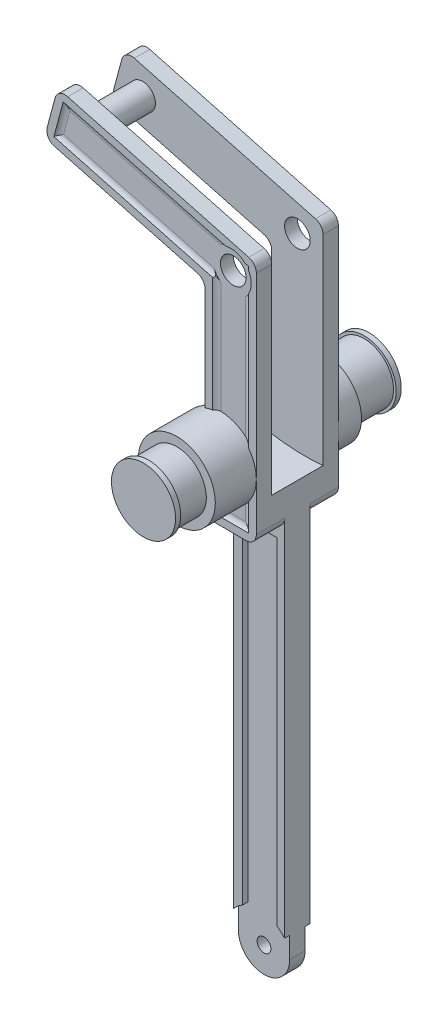
from build123d import *

# Parameters (mm, degrees)
ESTRUSIONE_ESTRUSIONE1_DEPTH  = 3
SCHIZZO4_R                    = 2.5
ESTRUSIONE_ESTRUSIONE4_DEPTH  = 5
ESTRUSIONE_ESTRUSIONE5_DEPTH  = 10
ESTRUSIONE_ESTRUSIONE6_START  = -13
ESTRUSIONE_ESTRUSIONE6_DEPTH  = 3
ESTRUSIONE_ESTRUSIONE7_DEPTH  = 2.5
TAGLIO_ESTRUSIONE1_DEPTH      = 0.5
TAGLIO_ESTRUSIONE2_DEPTH      = 0.5
RACCORDO1_R                   = 1.5
SCHIZZO13_R                   = 2.5
TAGLIO_ESTRUSIONE5_DEPTH      = 275
SCHIZZO14_W                   = 10
SCHIZZO14_H                   = 5
ESTRUSIONE_ESTRUSIONE8_DEPTH  = 10
TAGLIO_ESTRUSIONE6_DEPTH      = 10
SCHIZZO17_R                   = 1.35
TAGLIO_ESTRUSIONE7_DEPTH      = 10
TAGLIO_ESTRUSIONE8_DEPTH      = 1
TAGLIO_ESTRUSIONE9_DEPTH      = 1
SCHIZZO20_R                   = 4
TAGLIO_ESTRUSIONE10_DEPTH     = 4
SCHIZZO21_R                   = 7.5
ESTRUSIONE_ESTRUSIONE9_DEPTH  = 8.5
RACCORDO6_R                   = 2
ESTRUSIONE_ESTRUSIONE10_START = 5
SCHIZZO23_R                   = 7.5
ESTRUSIONE_ESTRUSIONE10_DEPTH = 5
RACCORDO9_R                   = 2
SCHIZZO25_R                   = 5.75
ESTRUSIONE_ESTRUSIONE11_DEPTH = 6.5
ESTRUSIONE_ESTRUSIONE12_START = 9
SCHIZZO26_R                   = 5.75
ESTRUSIONE_ESTRUSIONE12_DEPTH = 9
SCHIZZO28_R                   = 6.25
ESTRUSIONE_ESTRUSIONE13_DEPTH = 1
ESTRUSIONE_ESTRUSIONE14_START = -1
SCHIZZO29_R                   = 6.25
ESTRUSIONE_ESTRUSIONE14_DEPTH = 1


with BuildPart() as part:
    # Schizzo1 → Estrusione-Estrusione1 (new body)
    with BuildSketch(Plane.XY):
        with BuildLine():
            Line((0, -1.534653976), (0, -38))
            ThreePointArc((0, -38), (0.585786438, -39.414213562), (2, -40))
            Line((2, -40), (8, -40))
            ThreePointArc((8, -40), (9.414213562, -39.414213562), (10, -38))
            Line((10, -38), (10, 6.138615904))
            ThreePointArc((10, 6.138615904), (9.586706681, 7.356138762), (8.51763809, 8.070467556))
            Line((8.51763809, 8.070467556), (-26.774053122, 17.526847716))
            ThreePointArc((-26.774053122, 17.526847716), (-28.291691212, 17.327046871), (-29.223542865, 16.112634154))
            Line((-29.223542865, 16.112634154), (-30.776457135, 10.317079196))
            ThreePointArc((-30.776457135, 10.317079196), (-30.57665629, 8.799441106), (-29.362243573, 7.867589453))
            Line((-29.362243573, 7.867589453), (-1.48236191, 0.397197677))
            ThreePointArc((-1.48236191, 0.397197677), (-0.413293319, -0.317131118), (0, -1.534653976))
        make_face()
    extrude(amount=-ESTRUSIONE_ESTRUSIONE1_DEPTH)

    # Schizzo4 → Estrusione-Estrusione4 (add)
    with BuildSketch(Plane(origin=(0, 0, -3), x_dir=(-1, 0, 0), z_dir=(0, 0, -1))):
        with Locations(Location((25.170370869, 11.920761449, 0), (0, 0, 180))):
            Circle(SCHIZZO4_R)
    estrusione_estrusione4 = extrude(amount=ESTRUSIONE_ESTRUSIONE4_DEPTH)

    # Schizzo5 → Estrusione-Estrusione5 (add)
    with BuildSketch(Plane(origin=(0, 0, -3), x_dir=(-1, 0, 0), z_dir=(0, 0, -1))):
        with BuildLine():
            Line((-10, -32.854406154), (-10, -38))
            ThreePointArc((-10, -38), (-9.414213562, -39.414213562), (-8, -40))
            Line((-8, -40), (-2, -40))
            ThreePointArc((-2, -40), (-0.585786438, -39.414213562), (0, -38))
            Line((0, -38), (0, -32.476991219))
            ThreePointArc((0, -32.476991219), (-4.988150852, -32.979654151), (-10, -32.854406154))
        make_face()
    estrusione_estrusione5 = extrude(amount=ESTRUSIONE_ESTRUSIONE5_DEPTH)

    # Specchia5: Estrusione-Estrusione4, Estrusione-Estrusione5 across Piano2
    add(estrusione_estrusione4.mirror(Plane(origin=(0, 0, -8), x_dir=(-1, 0, 0), z_dir=(0, 0, -1))))
    add(estrusione_estrusione5.mirror(Plane(origin=(0, 0, -8), x_dir=(-1, 0, 0), z_dir=(0, 0, -1))))

    # Schizzo1<5> → Estrusione-Estrusione6 (add)
    with BuildSketch(Plane.XY.offset(ESTRUSIONE_ESTRUSIONE6_START)):
        with BuildLine():
            Line((0, -1.534653976), (0, -38))
            ThreePointArc((0, -38), (0.585786438, -39.414213562), (2, -40))
            Line((2, -40), (8, -40))
            ThreePointArc((8, -40), (9.414213562, -39.414213562), (10, -38))
            Line((10, -38), (10, 6.138615904))
            ThreePointArc((10, 6.138615904), (9.586706681, 7.356138762), (8.51763809, 8.070467556))
            Line((8.51763809, 8.070467556), (-26.774053122, 17.526847716))
            ThreePointArc((-26.774053122, 17.526847716), (-28.291691212, 17.327046871), (-29.223542865, 16.112634154))
            Line((-29.223542865, 16.112634154), (-30.776457135, 10.317079196))
            ThreePointArc((-30.776457135, 10.317079196), (-30.57665629, 8.799441106), (-29.362243573, 7.867589453))
            Line((-29.362243573, 7.867589453), (-1.48236191, 0.397197677))
            ThreePointArc((-1.48236191, 0.397197677), (-0.413293319, -0.317131118), (0, -1.534653976))
        make_face()
    extrude(amount=-ESTRUSIONE_ESTRUSIONE6_DEPTH)

    # Schizzo8 → Estrusione-Estrusione7 (add, symmetric)
    with BuildSketch(Plane(origin=(0, 0, -8), x_dir=(-1, 0, 0), z_dir=(0, 0, -1))):
        with BuildLine():
            Line((-8, -40), (-2, -40))
            ThreePointArc((-2, -40), (-0.585786438, -39.414213562), (0, -38))
            Line((0, -38), (0, -108))
            Line((0, -108), (-10, -108))
            Line((-10, -108), (-10, -38))
            ThreePointArc((-10, -38), (-9.414213562, -39.414213562), (-8, -40))
        make_face()
    extrude(amount=ESTRUSIONE_ESTRUSIONE7_DEPTH, both=True)

    # Schizzo9 → Taglio-Estrusione1 (cut, symmetric)
    with BuildSketch(Plane(origin=(0, 0, -16), x_dir=(-1, 0, 0), z_dir=(0, 0, -1))):
        Polygon((-8.5, -38.5), (-8.5, 6.522279398), (27.645244603, 16.207368499), (29.456977918, 9.445887715), (-1.5, 1.150990482), (-1.5, -38.5), align=None)
    extrude(amount=TAGLIO_ESTRUSIONE1_DEPTH, both=True, mode=Mode.SUBTRACT)

    # Schizzo10 → Taglio-Estrusione2 (cut, symmetric)
    with BuildSketch(Plane.XY):
        Polygon((8.5, 6.522279398), (-27.645244603, 16.207368499), (-29.456977918, 9.445887715), (1.5, 1.150990482), (1.5, -38.5), (8.5, -38.5), (8.5, -0.724653865), align=None)
    extrude(amount=TAGLIO_ESTRUSIONE2_DEPTH, both=True, mode=Mode.SUBTRACT)

    # Raccordo1
    # the kernel refuses this fillet: 1.5 mm, written as the material it adds along each edge
    with BuildSketch(Plane(origin=(1.5, -38.5, -0.5), x_dir=(0, 0, 1), z_dir=(1, 0, 0)), Plane(origin=(-27.645244603, 16.207368499, -0.5), x_dir=(0, 0, 1), z_dir=(-0.2588190451025157, -0.9659258262890696, 0))) as raccordo1_piece_1:
        with BuildLine():
            CenterArc((1.5, -1.118033989), RACCORDO1_R, 131.810314896, 48.189685104)
            Line((0, -1.118033989), (0, 0))
            Line((0, 0), (0.5, 0))
        make_face()
    extrude(amount=7)
    with BuildSketch(Plane(origin=(8.5, -38.5, -0.5), x_dir=(0, 0, 1), z_dir=(0, 1, 0))) as raccordo1_piece_2_section:
        with BuildLine():
            CenterArc((1.5, -1.118033989), RACCORDO1_R, 131.810314896, 48.189685104)
            Line((0, -1.118033989), (0, 0))
            Line((0, 0), (0.5, 0))
        make_face()
    raccordo1_piece_2 = extrude(amount=47.81736437, mode=Mode.PRIVATE)
    raccordo1_piece_2 = split(raccordo1_piece_2, bisect_by=Plane(origin=(19.755569849, 3.506358546, -0.5), z_dir=(-0.2588190451025174, -0.9659258262890692, 0)), keep=Keep.TOP, mode=Mode.PRIVATE)
    add(raccordo1_piece_2)
    with BuildSketch(Plane(origin=(1.5, 3.946075454, -0.5), x_dir=(0, 0, 1), z_dir=(0, -1, 0))) as raccordo1_piece_3_section:
        with BuildLine():
            CenterArc((1.5, -1.118033989), RACCORDO1_R, 131.810314896, 48.189685104)
            Line((0, -1.118033989), (0, 0))
            Line((0, 0), (0.5, 0))
        make_face()
    raccordo1_piece_3 = extrude(amount=42.446075454, mode=Mode.PRIVATE)
    raccordo1_piece_3 = split(raccordo1_piece_3, bisect_by=Plane(origin=(0.801228757, 1.338225672, -0.5), z_dir=(-0.2588190451025179, -0.9659258262890691, 0)), keep=Keep.TOP, mode=Mode.PRIVATE)
    add(raccordo1_piece_3)
    with BuildSketch(Plane(origin=(-29.456977918, 9.445887715, -0.5), x_dir=(0, 0, 1), z_dir=(0.9659258262890691, -0.2588190451025179, 0))) as raccordo1_piece_4_section:
        with BuildLine():
            CenterArc((1.5, -1.118033989), RACCORDO1_R, 131.810314896, 48.189685104)
            Line((0, -1.118033989), (0, 0))
            Line((0, 0), (0.5, 0))
        make_face()
    raccordo1_piece_4 = extrude(amount=34.844106828, mode=Mode.PRIVATE)
    raccordo1_piece_4 = split(raccordo1_piece_4, bisect_by=Plane(origin=(1.5, 9.445887715, -0.5), z_dir=(-1, 0, 0)), keep=Keep.TOP, mode=Mode.PRIVATE)
    add(raccordo1_piece_4)
    with BuildSketch(Plane(origin=(11.199844761, 5.798858174, -0.5), x_dir=(0, 0, 1), z_dir=(-0.9659258262890692, 0.2588190451025174, 0))) as raccordo1_piece_5_section:
        with BuildLine():
            CenterArc((1.5, -1.118033989), RACCORDO1_R, 131.810314896, 48.189685104)
            Line((0, -1.118033989), (0, 0))
            Line((0, 0), (0.5, 0))
        make_face()
    raccordo1_piece_5 = extrude(amount=40.215395744, mode=Mode.PRIVATE)
    raccordo1_piece_5 = split(raccordo1_piece_5, bisect_by=Plane(origin=(8.5, 5.798858174, -0.5), z_dir=(-1, 0, 0)), keep=Keep.TOP, mode=Mode.PRIVATE)
    add(raccordo1_piece_5)
    with BuildSketch(Plane(origin=(1.5, 3.946075454, -15.5), x_dir=(0, 0, -1), z_dir=(0, -1, 0))) as raccordo1_piece_6_section:
        with BuildLine():
            CenterArc((1.5, 1.118033989), RACCORDO1_R, 180, 48.189685104)
            Line((0, 1.118033989), (0, 0))
            Line((0, 0), (0.5, 0))
        make_face()
    raccordo1_piece_6 = extrude(amount=42.446075454, mode=Mode.PRIVATE)
    raccordo1_piece_6 = split(raccordo1_piece_6, bisect_by=Plane(origin=(0.801228757, 1.338225672, -15.5), z_dir=(-0.25881904510251796, -0.9659258262890691, 0)), keep=Keep.TOP, mode=Mode.PRIVATE)
    add(raccordo1_piece_6)
    with BuildSketch(Plane(origin=(1.5, -38.5, -15.5), x_dir=(0, 0, -1), z_dir=(1, 0, 0)), Plane(origin=(-27.645244603, 16.207368499, -15.5), x_dir=(0, 0, -1), z_dir=(-0.2588190451025171, -0.9659258262890693, 0))) as raccordo1_piece_7:
        with BuildLine():
            CenterArc((1.5, 1.118033989), RACCORDO1_R, 180, 48.189685104)
            Line((0, 1.118033989), (0, 0))
            Line((0, 0), (0.5, 0))
        make_face()
    extrude(amount=7)
    with BuildSketch(Plane(origin=(8.5, -38.5, -15.5), x_dir=(0, 0, -1), z_dir=(0, 1, 0))) as raccordo1_piece_8_section:
        with BuildLine():
            CenterArc((1.5, 1.118033989), RACCORDO1_R, 180, 48.189685104)
            Line((0, 1.118033989), (0, 0))
            Line((0, 0), (0.5, 0))
        make_face()
    raccordo1_piece_8 = extrude(amount=47.81736437, mode=Mode.PRIVATE)
    raccordo1_piece_8 = split(raccordo1_piece_8, bisect_by=Plane(origin=(19.755569849, 3.506358546, -15.5), z_dir=(-0.2588190451025175, -0.9659258262890692, 0)), keep=Keep.TOP, mode=Mode.PRIVATE)
    add(raccordo1_piece_8)
    with BuildSketch(Plane(origin=(11.199844761, 5.798858174, -15.5), x_dir=(0, 0, -1), z_dir=(-0.9659258262890692, 0.2588190451025175, 0))) as raccordo1_piece_9_section:
        with BuildLine():
            CenterArc((1.5, 1.118033989), RACCORDO1_R, 180, 48.189685104)
            Line((0, 1.118033989), (0, 0))
            Line((0, 0), (0.5, 0))
        make_face()
    raccordo1_piece_9 = extrude(amount=40.215395744, mode=Mode.PRIVATE)
    raccordo1_piece_9 = split(raccordo1_piece_9, bisect_by=Plane(origin=(8.5, 5.798858174, -15.5), z_dir=(-1, 0, 0)), keep=Keep.TOP, mode=Mode.PRIVATE)
    add(raccordo1_piece_9)
    with BuildSketch(Plane(origin=(-29.456977918, 9.445887715, -15.5), x_dir=(0, 0, -1), z_dir=(0.9659258262890691, -0.25881904510251796, 0))) as raccordo1_piece_10_section:
        with BuildLine():
            CenterArc((1.5, 1.118033989), RACCORDO1_R, 180, 48.189685104)
            Line((0, 1.118033989), (0, 0))
            Line((0, 0), (0.5, 0))
        make_face()
    raccordo1_piece_10 = extrude(amount=34.844106828, mode=Mode.PRIVATE)
    raccordo1_piece_10 = split(raccordo1_piece_10, bisect_by=Plane(origin=(1.5, 9.445887715, -15.5), z_dir=(-1, 0, 0)), keep=Keep.TOP, mode=Mode.PRIVATE)
    add(raccordo1_piece_10)
    with BuildSketch(Plane(origin=(-29.456977918, 9.445887715, -0.5), x_dir=(0, 0, 1), z_dir=(0.9659258262890691, -0.2588190451025179, 0))) as raccordo1_piece_11a_section:
        with BuildLine():
            CenterArc((1.5, -1.118033989), RACCORDO1_R, 131.810314896, 48.189685104)
            Line((0, -1.118033989), (0, 0))
            Line((0, 0), (0.5, 0))
        make_face()
    raccordo1_piece_11a = extrude(amount=34.844106828, mode=Mode.PRIVATE)
    raccordo1_piece_11a = split(raccordo1_piece_11a, bisect_by=Plane(origin=(1.5, 9.445887715, -0.5), z_dir=(1, 0, 0)), keep=Keep.TOP, mode=Mode.PRIVATE)
    with BuildSketch(Plane(origin=(1.5, 3.946075454, -0.5), x_dir=(0, 0, 1), z_dir=(0, -1, 0))) as raccordo1_piece_11b_section:
        with BuildLine():
            CenterArc((1.5, -1.118033989), RACCORDO1_R, 131.810314896, 48.189685104)
            Line((0, -1.118033989), (0, 0))
            Line((0, 0), (0.5, 0))
        make_face()
    raccordo1_piece_11b = extrude(amount=42.446075454, mode=Mode.PRIVATE)
    raccordo1_piece_11b = split(raccordo1_piece_11b, bisect_by=Plane(origin=(0.801228757, 1.338225672, -0.5), z_dir=(0.2588190451025179, 0.9659258262890691, 0)), keep=Keep.TOP, mode=Mode.PRIVATE)
    raccordo1_piece_11 = raccordo1_piece_11a & raccordo1_piece_11b
    add(raccordo1_piece_11)
    with BuildSketch(Plane(origin=(-29.456977918, 9.445887715, -15.5), x_dir=(0, 0, -1), z_dir=(0.9659258262890691, -0.25881904510251796, 0))) as raccordo1_piece_12a_section:
        with BuildLine():
            CenterArc((1.5, 1.118033989), RACCORDO1_R, 180, 48.189685104)
            Line((0, 1.118033989), (0, 0))
            Line((0, 0), (0.5, 0))
        make_face()
    raccordo1_piece_12a = extrude(amount=34.844106828, mode=Mode.PRIVATE)
    raccordo1_piece_12a = split(raccordo1_piece_12a, bisect_by=Plane(origin=(1.5, 9.445887715, -15.5), z_dir=(1, 0, 0)), keep=Keep.TOP, mode=Mode.PRIVATE)
    with BuildSketch(Plane(origin=(1.5, 3.946075454, -15.5), x_dir=(0, 0, -1), z_dir=(0, -1, 0))) as raccordo1_piece_12b_section:
        with BuildLine():
            CenterArc((1.5, 1.118033989), RACCORDO1_R, 180, 48.189685104)
            Line((0, 1.118033989), (0, 0))
            Line((0, 0), (0.5, 0))
        make_face()
    raccordo1_piece_12b = extrude(amount=42.446075454, mode=Mode.PRIVATE)
    raccordo1_piece_12b = split(raccordo1_piece_12b, bisect_by=Plane(origin=(0.801228757, 1.338225672, -15.5), z_dir=(0.25881904510251796, 0.9659258262890691, 0)), keep=Keep.TOP, mode=Mode.PRIVATE)
    raccordo1_piece_12 = raccordo1_piece_12a & raccordo1_piece_12b
    add(raccordo1_piece_12)

    # Schizzo13 → Taglio-Estrusione5 (cut, symmetric)
    with BuildSketch(Plane.XY.offset(-0.5)):
        with Locations((5, 3.83663494)):
            Circle(SCHIZZO13_R)
    extrude(amount=TAGLIO_ESTRUSIONE5_DEPTH, both=True, mode=Mode.SUBTRACT)

    # Schizzo14 → Estrusione-Estrusione8 (add)
    with BuildSketch(Plane.XZ.offset(108)):
        with Locations((5, -8)):
            Rectangle(SCHIZZO14_W, SCHIZZO14_H)
    extrude(amount=ESTRUSIONE_ESTRUSIONE8_DEPTH)

    # Schizzo16 → Taglio-Estrusione6 (cut)
    with BuildSketch(Plane.XY.offset(-5.5)):
        with BuildLine():
            Line((0, -113), (-2.523902075, -113))
            Line((-2.523902075, -113), (-2.523902075, -123.194000157))
            Line((-2.523902075, -123.194000157), (14.589849189, -123.194000157))
            Line((14.589849189, -123.194000157), (14.589849189, -113))
            Line((14.589849189, -113), (10, -113))
            ThreePointArc((10, -113), (5, -118), (0, -113))
        make_face()
    extrude(amount=-TAGLIO_ESTRUSIONE6_DEPTH, mode=Mode.SUBTRACT)

    # Schizzo17 → Taglio-Estrusione7 (cut)
    with BuildSketch(Plane.XY.offset(-5.5)):
        with Locations((5, -113)):
            Circle(SCHIZZO17_R)
    extrude(amount=-TAGLIO_ESTRUSIONE7_DEPTH, mode=Mode.SUBTRACT)

    # Schizzo18 → Taglio-Estrusione8 (cut)
    with BuildSketch(Plane(origin=(0, 0, -10.5), x_dir=(-1, 0, 0), z_dir=(0, 0, -1))):
        with BuildLine():
            Line((-8.5, -42), (-1.5, -42))
            Line((-1.5, -42), (-1.5, -107.554305303))
            ThreePointArc((-1.5, -107.554305303), (-5, -119.473452768), (-8.5, -107.554305303))
            Line((-8.5, -107.554305303), (-8.5, -42))
        make_face()
    extrude(amount=-TAGLIO_ESTRUSIONE8_DEPTH, mode=Mode.SUBTRACT)

    # Schizzo19 → Taglio-Estrusione9 (cut)
    with BuildSketch(Plane.XY.offset(-5.5)):
        with BuildLine():
            Line((1.828964211, -42), (1.828964211, -107.352254253))
            ThreePointArc((1.828964211, -107.352254253), (4.80808802, -119.474231212), (8.5, -107.55))
            Line((8.5, -107.55), (8.5, -42))
            Line((8.5, -42), (1.828964211, -42))
        make_face()
    extrude(amount=-TAGLIO_ESTRUSIONE9_DEPTH, mode=Mode.SUBTRACT)

    # Schizzo20 → Taglio-Estrusione10 (cut)
    with BuildSketch(Plane.XY.offset(-0.5)):
        with Locations((5, 3.83663494)):
            Circle(SCHIZZO20_R)
    extrude(amount=TAGLIO_ESTRUSIONE10_DEPTH, mode=Mode.SUBTRACT)

    # Schizzo21 → Estrusione-Estrusione9 (add)
    with BuildSketch(Plane.XY.offset(-0.5)):
        with Locations((2.5, -28.66336506)):
            Circle(SCHIZZO21_R)
    extrude(amount=ESTRUSIONE_ESTRUSIONE9_DEPTH)

    # Raccordo6
    raccordo6_edges = [part.edges().sort_by_distance(p)[0] for p in [
        (0, -28.66336506, -0.5),
    ]]
    fillet(raccordo6_edges, radius=RACCORDO6_R)

    # Schizzo23 → Estrusione-Estrusione10 (add)
    with BuildSketch(Plane(origin=(0, 0, -15.5), x_dir=(-1, 0, 0), z_dir=(0, 0, -1)).offset(ESTRUSIONE_ESTRUSIONE10_START)):
        with Locations(Location((-2.5, -28.66336506, 0), (0, 0, 180))):
            Circle(SCHIZZO23_R)
    extrude(amount=-ESTRUSIONE_ESTRUSIONE10_DEPTH)

    # Raccordo9
    raccordo9_edges = [part.edges().sort_by_distance(p)[0] for p in [
        (0, -28.66336506, -15.5),
    ]]
    fillet(raccordo9_edges, radius=RACCORDO9_R)

    # Schizzo25 → Estrusione-Estrusione11 (add)
    with BuildSketch(Plane.XY.offset(8)):
        with Locations(Location((2.5, -28.66336506, 0), (0, 0, 180))):
            Circle(SCHIZZO25_R)
    extrude(amount=ESTRUSIONE_ESTRUSIONE11_DEPTH)

    # Schizzo26 → Estrusione-Estrusione12 (add)
    with BuildSketch(Plane(origin=(0, 0, -20.5), x_dir=(-1, 0, 0), z_dir=(0, 0, -1)).offset(ESTRUSIONE_ESTRUSIONE12_START)):
        with Locations((-2.5, -28.66336506)):
            Circle(SCHIZZO26_R)
    extrude(amount=-ESTRUSIONE_ESTRUSIONE12_DEPTH)

    # Schizzo28 → Estrusione-Estrusione13 (add)
    with BuildSketch(Plane.XY.offset(14.5)):
        with Locations((2.5, -28.66336506)):
            Circle(SCHIZZO28_R)
    extrude(amount=-ESTRUSIONE_ESTRUSIONE13_DEPTH)

    # Schizzo29 → Estrusione-Estrusione14 (add)
    with BuildSketch(Plane(origin=(0, 0, -29.5), x_dir=(-1, 0, 0), z_dir=(0, 0, -1)).offset(ESTRUSIONE_ESTRUSIONE14_START)):
        with Locations(Location((-2.5, -28.66336506, 0), (0, 0, 180))):
            Circle(SCHIZZO29_R)
    extrude(amount=ESTRUSIONE_ESTRUSIONE14_DEPTH)


solid = part.part
